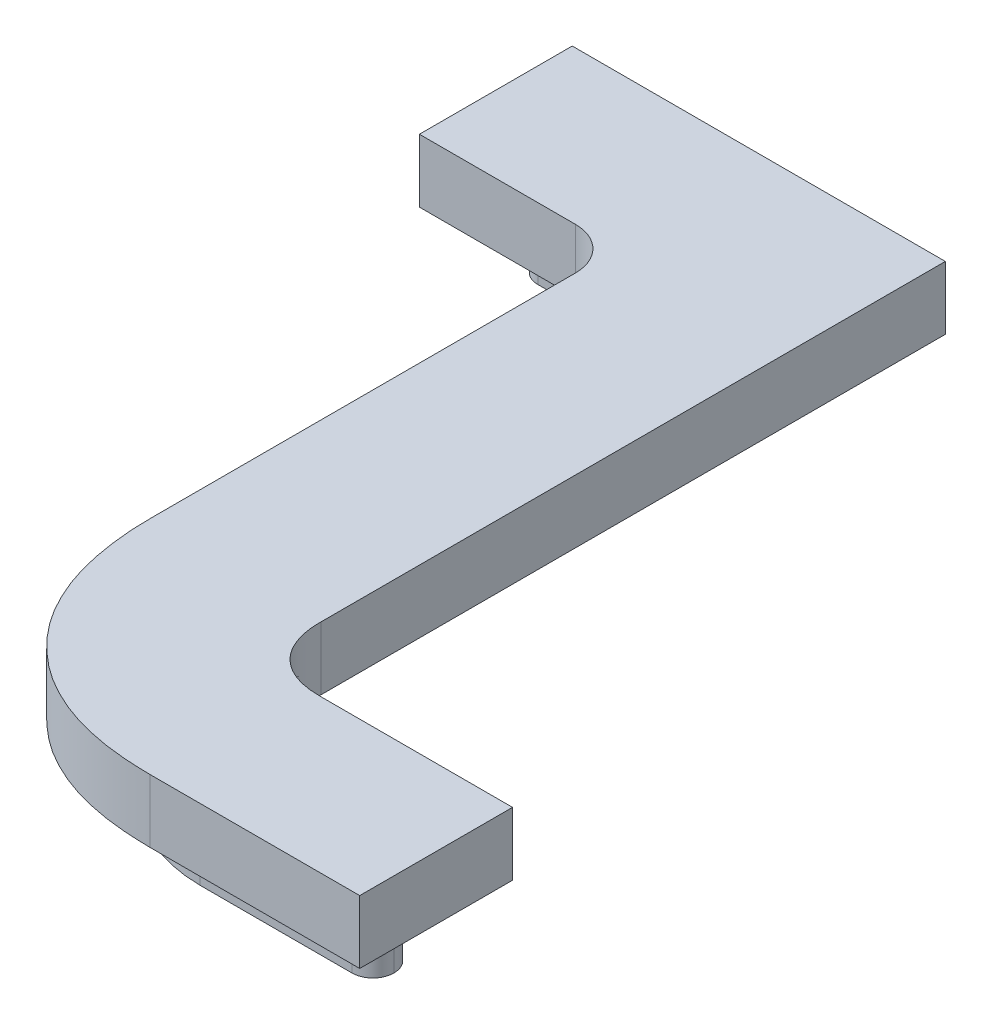
from build123d import *

# Parameters (mm, degrees)
EXTRUDE_L_DEPTH        = 15
EXTRUDE_951_DEPTH      = 15
FILLET_1044_R          = 5
SKETCH_1306_R          = 1.5
CUT_EXTRUDE_1314_DEPTH = 251.162599761


with BuildPart() as part:
    # Эскиз l → l (new body)
    with BuildSketch(Plane(origin=(0, 0, 0), x_dir=(1, 0, 0), z_dir=(0, 1, 0))):
        with BuildLine():
            Line((0, 163.701923077), (0, 200))
            Line((0, 200), (88.622884615, 200))
            Line((88.622884615, 200), (88.622884615, 51.682692308))
            add(Edge.make_bspline(
                [(88.622884615, 51.682692308), (88.584324136, 49.498745129), (89.03409536, 46.314042521), (90.756066544, 42.548836596), (92.543680506, 40.272944728), (94.800293255, 38.479885865), (98.492933692, 36.6691907), (101.687793554, 36.288646199), (103.84724359, 36.298076923)],
                knots=[0, 0, 0, 0, 0.266770811, 0.385688366, 0.501833832, 0.616701353, 0.734856032, 1, 1, 1, 1], degree=3))
            Line((103.84724359, 36.298076923), (149.520320513, 36.298076923))
            Line((149.520320513, 36.298076923), (149.520320513, 0))
            Line((149.520320513, 0), (99.680576923, 0))
            add(Edge.make_bspline(
                [(99.680576923, 0), (95.787985552, 0.056561193), (90.049186966, 0.354248464), (82.756449757, 1.913423248), (77.722410387, 3.420669789), (73.047421178, 5.435773635), (68.65960796, 7.842675126), (64.657079117, 10.74400138), (60.988860255, 14.046426407), (57.696300151, 17.73067833), (54.833554235, 21.805264076), (52.441129709, 26.224868693), (50.453789108, 30.958007277), (48.934002029, 36.035784324), (47.490582867, 43.441868234), (47.022391454, 49.220591435), (47.076410256, 53.165064103)],
                knots=[0, 0, 0, 0, 0.137920176, 0.202111555, 0.263363656, 0.323455843, 0.381806019, 0.440003085, 0.497856099, 0.556060831, 0.614368942, 0.673546606, 0.733454771, 0.79561061, 0.860632327, 1, 1, 1, 1], degree=3))
            Line((47.076410256, 53.165064103), (47.076410256, 153.701923077))
            ThreePointArc((47.076410256, 153.701923077), (44.147478068, 160.772990889), (37.076410256, 163.701923077))
            Line((37.076410256, 163.701923077), (0, 163.701923077))
        make_face()
    extrude(amount=EXTRUDE_L_DEPTH)

    # Sketch 848 → Extrude 951 (add)
    with BuildSketch(Plane(origin=(0, 0, 0), x_dir=(1, 0, 0), z_dir=(0, 1, 0))):
        with BuildLine():
            Line((10, 176.8490385), (52.853237, 176.8490385))
            ThreePointArc((52.853237, 176.8490385), (59.924304812, 173.920106312), (62.853237, 166.8490385))
            Line((62.853237, 166.8490385), (62.853237, 49.040393573))
            ThreePointArc((62.853237, 49.040393573), (73.181783835, 23.845809353), (98.223159353, 13.151162754))
            ThreePointArc((98.223159353, 13.151162754), (98.368899816, 13.149569571), (98.514648019, 13.1490385))
            Line((98.514648019, 13.1490385), (139.520321, 13.1490385))
            Line((139.520321, 13.1490385), (139.520321, 23.1490385))
            Line((139.520321, 23.1490385), (98.514648019, 23.1490385))
            ThreePointArc((98.514648019, 23.1490385), (98.441773917, 23.149304035), (98.368903686, 23.150100627))
            ThreePointArc((98.368903686, 23.150100627), (80.304193656, 30.865159632), (72.853237, 49.040393573))
            Line((72.853237, 49.040393573), (72.853237, 166.8490385))
            ThreePointArc((72.853237, 166.8490385), (66.995372624, 180.991174124), (52.853237, 186.8490385))
            Line((52.853237, 186.8490385), (10, 186.8490385))
            Line((10, 186.8490385), (10, 176.8490385))
        make_face()
    extrude(amount=-EXTRUDE_951_DEPTH)

    # Fillet 1044
    fillet_1044_edges = [part.edges().sort_by_distance(p)[0] for p in [
        (139.520321, -7.5, -13.1490385),
        (139.520321, -7.5, -23.1490385),
        (10, -7.5, -176.8490385),
        (10, -7.5, -186.8490385),
    ]]
    fillet(fillet_1044_edges, radius=FILLET_1044_R - 0.0001)  # a hair under: the kernel refuses the full size

    # Sketch 1306 → Cut-Extrude 1314 (cut, through all)
    with BuildSketch(Plane(origin=(0, 0, 0), x_dir=(1, 0, 0), z_dir=(0, 1, 0))):
        with Locations(Location((15, 181.849039, 0), (0, 0, 270))):
            Circle(SKETCH_1306_R)
        with Locations(Location((67.853237, 100, 0), (0, 0, 270))):
            Circle(SKETCH_1306_R)
        with Locations(Location((134.52, 18.149039, 0), (0, 0, 270))):
            Circle(SKETCH_1306_R)
    extrude(amount=-CUT_EXTRUDE_1314_DEPTH, mode=Mode.SUBTRACT)


solid = part.part
